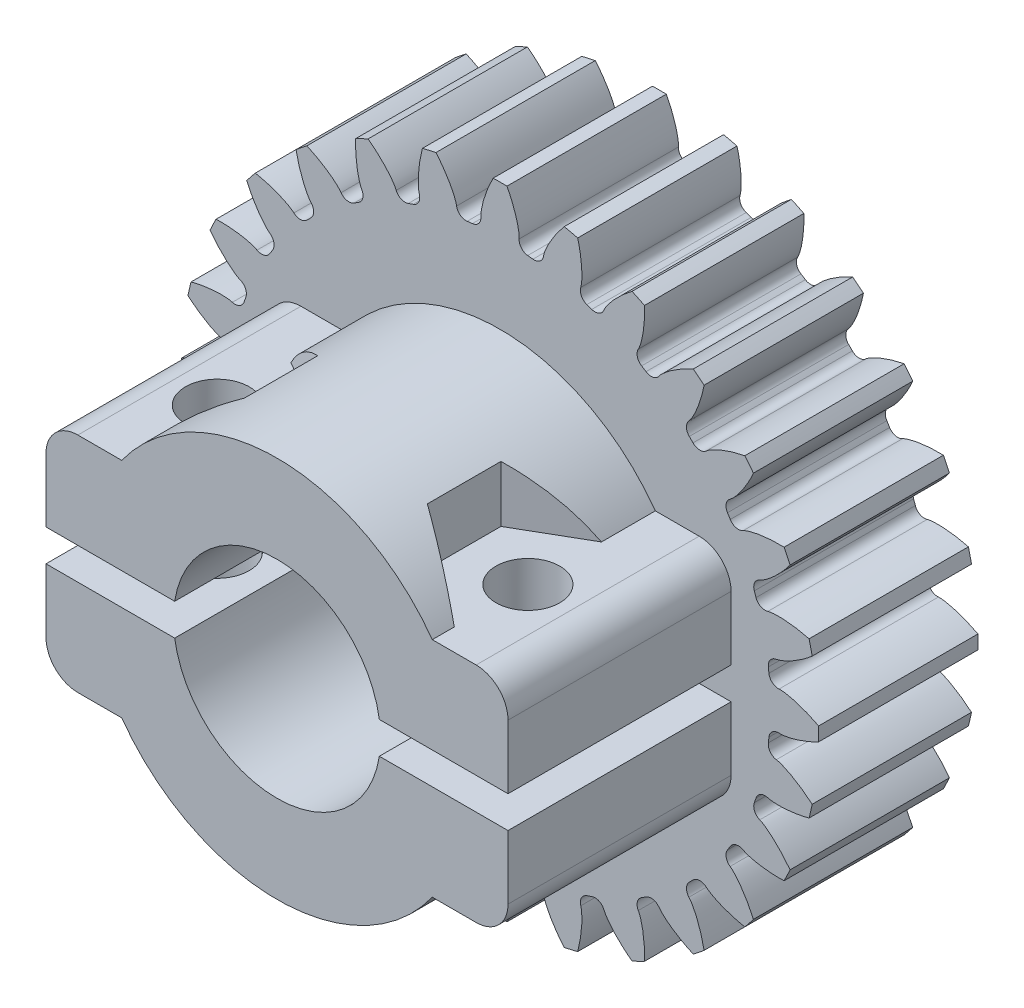
from build123d import *

# Parameters (mm, degrees)
BOSS_EXTRUDE1_DEPTH      = 5
F_6_0_6_DIAMETER_HOLE1_D = 6
FILLET1_R                = 0.300012354
SKETCH4_R                = 6
SKETCH4_R_2              = 3
BOSS_EXTRUDE2_DEPTH      = 7
CUT_EXTRUDE1_DEPTH       = 10
CUT_EXTRUDE1_DEPTH_BACK  = 11.5
SKETCH5_R                = 3.25
SKETCH5_R_2              = 1
BOSS_EXTRUDE3_DEPTH      = 7
SKETCH7_W                = 14.5
SKETCH7_H                = 1
CUT_EXTRUDE2_DEPTH       = 7
SKETCH8_R                = 1
CUT_EXTRUDE3_DEPTH       = 7
SKETCH9_R                = 2
CUT_EXTRUDE4_DEPTH       = 7
CUT_EXTRUDE5_DEPTH       = 7


with BuildPart() as part:
    # Sketch1 → Boss-Extrude1 (new body)
    with BuildSketch(Plane.XY.offset(3)):
        with BuildLine():
            ThreePointArc((9.698727559, -2.436120634), (9.749279122, -2.22520934), (9.795244718, -2.013251328))
            add(Edge.make_bspline(
                [(9.795244718, -2.013251328), (9.132310444, -1.434916085), (8.667338514, -1.363860765)],
                knots=[1.102675536, 1.102675536, 1.102675536, 2.694068119, 2.694068119, 2.694068119], degree=2, weights=[1, 0.699787539, 1]))
            add(Edge.make_bspline(
                [(8.667338514, -1.363860765), (8.571579262, -1.347671583), (8.475468614, -1.333203337), (8.379532055, -1.317882503)],
                knots=[0, 0, 0, 0, 1, 1, 1, 1], degree=3))
            ThreePointArc((8.379532055, -1.317882503), (8.429196944, -0.949742401), (8.462696137, -0.579780862))
            add(Edge.make_bspline(
                [(8.753517812, -0.598998333), (8.656557013, -0.59347318), (8.559636572, -0.586192045), (8.462696137, -0.579780862)],
                knots=[0, 0, 0, 0, 1, 1, 1, 1], degree=3))
            add(Edge.make_bspline(
                [(8.753517812, -0.598998333), (9.236542381, -0.624281572), (9.997648048, -0.216872089)],
                knots=[3.629487151, 3.629487151, 3.629487151, 5.119391363, 5.119391363, 5.119391363], degree=2, weights=[1, 0.735120372, 1]))
            ThreePointArc((9.997648048, -0.216872089), (10, 0), (9.997648048, 0.216872089))
            add(Edge.make_bspline(
                [(9.997648048, 0.216872089), (9.222643222, 0.633190506), (8.753517812, 0.598998333)],
                knots=[1.102675536, 1.102675536, 1.102675536, 2.694068119, 2.694068119, 2.694068119], degree=2, weights=[1, 0.699787539, 1]))
            add(Edge.make_bspline(
                [(8.753517812, 0.598998333), (8.656557013, 0.59347318), (8.559636572, 0.586192045), (8.462696137, 0.579780862)],
                knots=[0, 0, 0, 0, 1, 1, 1, 1], degree=3))
            ThreePointArc((8.462696137, 0.579780862), (8.429196944, 0.949742401), (8.379532055, 1.317882503))
            add(Edge.make_bspline(
                [(8.667338514, 1.363860765), (8.571579262, 1.347671583), (8.475468614, 1.333203337), (8.379532055, 1.317882503)],
                knots=[0, 0, 0, 0, 1, 1, 1, 1], degree=3))
            add(Edge.make_bspline(
                [(8.667338514, 1.363860765), (9.143878697, 1.446694507), (9.795244718, 2.013251328)],
                knots=[3.629487151, 3.629487151, 3.629487151, 5.119391363, 5.119391363, 5.119391363], degree=2, weights=[1, 0.735120372, 1]))
            ThreePointArc((9.795244718, 2.013251328), (9.749279122, 2.22520934), (9.698727559, 2.436120634))
            add(Edge.make_bspline(
                [(9.698727559, 2.436120634), (8.850514158, 2.669546282), (8.400759177, 2.531821153)],
                knots=[1.102675536, 1.102675536, 1.102675536, 2.694068119, 2.694068119, 2.694068119], degree=2, weights=[1, 0.699787539, 1]))
            add(Edge.make_bspline(
                [(8.400759177, 2.531821153), (8.307458849, 2.50485872), (8.214588611, 2.476193311), (8.121505297, 2.448371593)],
                knots=[0, 0, 0, 0, 1, 1, 1, 1], degree=3))
            ThreePointArc((8.121505297, 2.448371593), (8.006521812, 2.801603152), (7.876183246, 3.149461736))
            add(Edge.make_bspline(
                [(8.14654267, 3.258330189), (8.056786734, 3.221238466), (7.966305269, 3.185746338), (7.876183246, 3.149461736)],
                knots=[0, 0, 0, 0, 1, 1, 1, 1], degree=3))
            add(Edge.make_bspline(
                [(8.14654267, 3.258330189), (8.592702755, 3.445127283), (9.101666916, 4.142421917)],
                knots=[0.487894497, 0.487894497, 0.487894497, 1.97779871, 1.97779871, 1.97779871], degree=2, weights=[1, 0.735120372, 1]))
            ThreePointArc((9.101666916, 4.142421917), (9.009688679, 4.338837391), (8.913472371, 4.533211918))
            add(Edge.make_bspline(
                [(8.913472371, 4.533211918), (8.034583358, 4.572039859), (7.626751397, 4.337687889)],
                knots=[1.102675536, 1.102675536, 1.102675536, 2.694068119, 2.694068119, 2.694068119], degree=2, weights=[1, 0.699787539, 1]))
            add(Edge.make_bspline(
                [(7.626751397, 4.337687889), (7.54179001, 4.290640184), (7.457626876, 4.242027905), (7.37306827, 4.194190749)],
                knots=[0, 0, 0, 0, 1, 1, 1, 1], degree=3))
            ThreePointArc((7.37306827, 4.194190749), (7.182366244, 4.512979823), (6.977889721, 4.823113807))
            add(Edge.make_bspline(
                [(7.21724516, 4.989413332), (7.137993278, 4.933279001), (7.057678113, 4.878542714), (6.977889721, 4.823113807)],
                knots=[0, 0, 0, 0, 1, 1, 1, 1], degree=3))
            add(Edge.make_bspline(
                [(7.21724516, 4.989413332), (7.610652816, 5.270806992), (7.95169353, 6.063874174)],
                knots=[3.629487151, 3.629487151, 3.629487151, 5.119391363, 5.119391363, 5.119391363], degree=2, weights=[1, 0.735120372, 1]))
            ThreePointArc((7.95169353, 6.063874174), (7.818314825, 6.234898019), (7.681258459, 6.402989027))
            add(Edge.make_bspline(
                [(7.681258459, 6.402989027), (6.815764999, 6.245272267), (6.470306456, 5.926044841)],
                knots=[1.102675536, 1.102675536, 1.102675536, 2.694068119, 2.694068119, 2.694068119], degree=2, weights=[1, 0.699787539, 1]))
            add(Edge.make_bspline(
                [(6.470306456, 5.926044841), (6.397944327, 5.861271033), (6.326708588, 5.795149506), (6.254914812, 5.729695668)],
                knots=[0, 0, 0, 0, 1, 1, 1, 1], degree=3))
            ThreePointArc((6.254914812, 5.729695668), (5.998056842, 5.998056842), (5.729695668, 6.254914812))
            add(Edge.make_bspline(
                [(5.926044841, 6.470306456), (5.861271033, 6.397944327), (5.795149506, 6.326708588), (5.729695668, 6.254914812)],
                knots=[0, 0, 0, 0, 1, 1, 1, 1], degree=3))
            add(Edge.make_bspline(
                [(5.926044841, 6.470306456), (6.246972966, 6.832186429), (6.402989027, 7.681258459)],
                knots=[0.487894497, 0.487894497, 0.487894497, 1.97779871, 1.97779871, 1.97779871], degree=2, weights=[1, 0.735120372, 1]))
            ThreePointArc((6.402989027, 7.681258459), (6.234898019, 7.818314825), (6.063874174, 7.95169353))
            add(Edge.make_bspline(
                [(6.063874174, 7.95169353), (5.255175723, 7.605340646), (4.989413332, 7.21724516)],
                knots=[1.102675536, 1.102675536, 1.102675536, 2.694068119, 2.694068119, 2.694068119], degree=2, weights=[1, 0.699787539, 1]))
            add(Edge.make_bspline(
                [(4.989413332, 7.21724516), (4.933279001, 7.137993278), (4.878542714, 7.057678113), (4.823113807, 6.977889721)],
                knots=[0, 0, 0, 0, 1, 1, 1, 1], degree=3))
            ThreePointArc((4.823113807, 6.977889721), (4.512979823, 7.182366244), (4.194190749, 7.37306827))
            add(Edge.make_bspline(
                [(4.337687889, 7.626751397), (4.290640184, 7.54179001), (4.242027905, 7.457626876), (4.194190749, 7.37306827)],
                knots=[0, 0, 0, 0, 1, 1, 1, 1], degree=3))
            add(Edge.make_bspline(
                [(4.337687889, 7.626751397), (4.570043806, 8.050971509), (4.533211918, 8.913472371)],
                knots=[0.487894497, 0.487894497, 0.487894497, 1.97779871, 1.97779871, 1.97779871], degree=2, weights=[1, 0.735120372, 1]))
            ThreePointArc((4.533211918, 8.913472371), (4.338837391, 9.009688679), (4.142421917, 9.101666916))
            add(Edge.make_bspline(
                [(4.142421917, 9.101666916), (3.431069992, 8.584045487), (3.258330189, 8.14654267)],
                knots=[1.102675536, 1.102675536, 1.102675536, 2.694068119, 2.694068119, 2.694068119], degree=2, weights=[1, 0.699787539, 1]))
            add(Edge.make_bspline(
                [(3.258330189, 8.14654267), (3.221238466, 8.056786734), (3.185746338, 7.966305269), (3.149461736, 7.876183246)],
                knots=[0, 0, 0, 0, 1, 1, 1, 1], degree=3))
            ThreePointArc((3.149461736, 7.876183246), (2.801603152, 8.006521812), (2.448371593, 8.121505297))
            add(Edge.make_bspline(
                [(2.531821153, 8.400759177), (2.50485872, 8.307458849), (2.476193311, 8.214588611), (2.448371593, 8.121505297)],
                knots=[0, 0, 0, 0, 1, 1, 1, 1], degree=3))
            add(Edge.make_bspline(
                [(2.531821153, 8.400759177), (2.663953567, 8.866047261), (2.436120634, 9.698727559)],
                knots=[0.487894497, 0.487894497, 0.487894497, 1.97779871, 1.97779871, 1.97779871], degree=2, weights=[1, 0.735120372, 1]))
            ThreePointArc((2.436120634, 9.698727559), (2.22520934, 9.749279122), (2.013251328, 9.795244718))
            add(Edge.make_bspline(
                [(2.013251328, 9.795244718), (1.434916085, 9.132310444), (1.363860765, 8.667338514)],
                knots=[4.24426819, 4.24426819, 4.24426819, 5.835660772, 5.835660772, 5.835660772], degree=2, weights=[1, 0.699787539, 1]))
            add(Edge.make_bspline(
                [(1.363860765, 8.667338514), (1.347671583, 8.571579262), (1.333203337, 8.475468614), (1.317882503, 8.379532055)],
                knots=[0, 0, 0, 0, 1, 1, 1, 1], degree=3))
            ThreePointArc((1.317882503, 8.379532055), (0.949742401, 8.429196944), (0.579780862, 8.462696137))
            add(Edge.make_bspline(
                [(0.598998333, 8.753517812), (0.59347318, 8.656557013), (0.586192045, 8.559636572), (0.579780862, 8.462696137)],
                knots=[0, 0, 0, 0, 1, 1, 1, 1], degree=3))
            add(Edge.make_bspline(
                [(0.598998333, 8.753517812), (0.624281572, 9.236542381), (0.216872089, 9.997648048)],
                knots=[0.487894497, 0.487894497, 0.487894497, 1.97779871, 1.97779871, 1.97779871], degree=2, weights=[1, 0.735120372, 1]))
            ThreePointArc((0.216872089, 9.997648048), (0, 10), (-0.216872089, 9.997648048))
            add(Edge.make_bspline(
                [(-0.216872089, 9.997648048), (-0.633190506, 9.222643222), (-0.598998333, 8.753517812)],
                knots=[4.24426819, 4.24426819, 4.24426819, 5.835660772, 5.835660772, 5.835660772], degree=2, weights=[1, 0.699787539, 1]))
            add(Edge.make_bspline(
                [(-0.598998333, 8.753517812), (-0.59347318, 8.656557013), (-0.586192045, 8.559636572), (-0.579780862, 8.462696137)],
                knots=[0, 0, 0, 0, 1, 1, 1, 1], degree=3))
            ThreePointArc((-0.579780862, 8.462696137), (-0.949742401, 8.429196944), (-1.317882503, 8.379532055))
            add(Edge.make_bspline(
                [(-1.363860765, 8.667338514), (-1.347671583, 8.571579262), (-1.333203337, 8.475468614), (-1.317882503, 8.379532055)],
                knots=[0, 0, 0, 0, 1, 1, 1, 1], degree=3))
            add(Edge.make_bspline(
                [(-1.363860765, 8.667338514), (-1.446694507, 9.143878697), (-2.013251328, 9.795244718)],
                knots=[0.487894497, 0.487894497, 0.487894497, 1.97779871, 1.97779871, 1.97779871], degree=2, weights=[1, 0.735120372, 1]))
            ThreePointArc((-2.013251328, 9.795244718), (-2.22520934, 9.749279122), (-2.436120634, 9.698727559))
            add(Edge.make_bspline(
                [(-2.436120634, 9.698727559), (-2.669546282, 8.850514158), (-2.531821153, 8.400759177)],
                knots=[4.24426819, 4.24426819, 4.24426819, 5.835660772, 5.835660772, 5.835660772], degree=2, weights=[1, 0.699787539, 1]))
            add(Edge.make_bspline(
                [(-2.531821153, 8.400759177), (-2.50485872, 8.307458849), (-2.476193311, 8.214588611), (-2.448371593, 8.121505297)],
                knots=[0, 0, 0, 0, 1, 1, 1, 1], degree=3))
            ThreePointArc((-2.448371593, 8.121505297), (-2.801603152, 8.006521812), (-3.149461736, 7.876183246))
            add(Edge.make_bspline(
                [(-3.258330189, 8.14654267), (-3.221238466, 8.056786734), (-3.185746338, 7.966305269), (-3.149461736, 7.876183246)],
                knots=[0, 0, 0, 0, 1, 1, 1, 1], degree=3))
            add(Edge.make_bspline(
                [(-3.258330189, 8.14654267), (-3.445127283, 8.592702755), (-4.142421917, 9.101666916)],
                knots=[0.487894497, 0.487894497, 0.487894497, 1.97779871, 1.97779871, 1.97779871], degree=2, weights=[1, 0.735120372, 1]))
            ThreePointArc((-4.142421917, 9.101666916), (-4.338837391, 9.009688679), (-4.533211918, 8.913472371))
            add(Edge.make_bspline(
                [(-4.533211918, 8.913472371), (-4.572039859, 8.034583358), (-4.337687889, 7.626751397)],
                knots=[4.24426819, 4.24426819, 4.24426819, 5.835660772, 5.835660772, 5.835660772], degree=2, weights=[1, 0.699787539, 1]))
            add(Edge.make_bspline(
                [(-4.337687889, 7.626751397), (-4.290640184, 7.54179001), (-4.242027905, 7.457626876), (-4.194190749, 7.37306827)],
                knots=[0, 0, 0, 0, 1, 1, 1, 1], degree=3))
            ThreePointArc((-4.194190749, 7.37306827), (-4.512979823, 7.182366244), (-4.823113807, 6.977889721))
            add(Edge.make_bspline(
                [(-4.989413332, 7.21724516), (-4.933279001, 7.137993278), (-4.878542714, 7.057678113), (-4.823113807, 6.977889721)],
                knots=[0, 0, 0, 0, 1, 1, 1, 1], degree=3))
            add(Edge.make_bspline(
                [(-4.989413332, 7.21724516), (-5.270806992, 7.610652816), (-6.063874174, 7.95169353)],
                knots=[0.487894497, 0.487894497, 0.487894497, 1.97779871, 1.97779871, 1.97779871], degree=2, weights=[1, 0.735120372, 1]))
            ThreePointArc((-6.063874174, 7.95169353), (-6.234898019, 7.818314825), (-6.402989027, 7.681258459))
            add(Edge.make_bspline(
                [(-6.402989027, 7.681258459), (-6.245272267, 6.815764999), (-5.926044841, 6.470306456)],
                knots=[4.24426819, 4.24426819, 4.24426819, 5.835660772, 5.835660772, 5.835660772], degree=2, weights=[1, 0.699787539, 1]))
            add(Edge.make_bspline(
                [(-5.926044841, 6.470306456), (-5.861271033, 6.397944327), (-5.795149506, 6.326708588), (-5.729695668, 6.254914812)],
                knots=[0, 0, 0, 0, 1, 1, 1, 1], degree=3))
            ThreePointArc((-5.729695668, 6.254914812), (-5.998056842, 5.998056842), (-6.254914812, 5.729695668))
            add(Edge.make_bspline(
                [(-6.470306456, 5.926044841), (-6.397944327, 5.861271033), (-6.326708588, 5.795149506), (-6.254914812, 5.729695668)],
                knots=[0, 0, 0, 0, 1, 1, 1, 1], degree=3))
            add(Edge.make_bspline(
                [(-6.470306456, 5.926044841), (-6.832186429, 6.246972966), (-7.681258459, 6.402989027)],
                knots=[0.487894497, 0.487894497, 0.487894497, 1.97779871, 1.97779871, 1.97779871], degree=2, weights=[1, 0.735120372, 1]))
            ThreePointArc((-7.681258459, 6.402989027), (-7.818314825, 6.234898019), (-7.95169353, 6.063874174))
            add(Edge.make_bspline(
                [(-7.95169353, 6.063874174), (-7.605340646, 5.255175723), (-7.21724516, 4.989413332)],
                knots=[1.102675536, 1.102675536, 1.102675536, 2.694068119, 2.694068119, 2.694068119], degree=2, weights=[1, 0.699787539, 1]))
            add(Edge.make_bspline(
                [(-7.21724516, 4.989413332), (-7.137993278, 4.933279001), (-7.057678113, 4.878542714), (-6.977889721, 4.823113807)],
                knots=[0, 0, 0, 0, 1, 1, 1, 1], degree=3))
            ThreePointArc((-6.977889721, 4.823113807), (-7.182366244, 4.512979823), (-7.37306827, 4.194190749))
            add(Edge.make_bspline(
                [(-7.626751397, 4.337687889), (-7.54179001, 4.290640184), (-7.457626876, 4.242027905), (-7.37306827, 4.194190749)],
                knots=[0, 0, 0, 0, 1, 1, 1, 1], degree=3))
            add(Edge.make_bspline(
                [(-7.626751397, 4.337687889), (-8.050971509, 4.570043806), (-8.913472371, 4.533211918)],
                knots=[3.629487151, 3.629487151, 3.629487151, 5.119391363, 5.119391363, 5.119391363], degree=2, weights=[1, 0.735120372, 1]))
            ThreePointArc((-8.913472371, 4.533211918), (-9.009688679, 4.338837391), (-9.101666916, 4.142421917))
            add(Edge.make_bspline(
                [(-9.101666916, 4.142421917), (-8.584045487, 3.431069992), (-8.14654267, 3.258330189)],
                knots=[4.24426819, 4.24426819, 4.24426819, 5.835660772, 5.835660772, 5.835660772], degree=2, weights=[1, 0.699787539, 1]))
            add(Edge.make_bspline(
                [(-8.14654267, 3.258330189), (-8.056786734, 3.221238466), (-7.966305269, 3.185746338), (-7.876183246, 3.149461736)],
                knots=[0, 0, 0, 0, 1, 1, 1, 1], degree=3))
            ThreePointArc((-7.876183246, 3.149461736), (-8.006521812, 2.801603152), (-8.121505297, 2.448371593))
            add(Edge.make_bspline(
                [(-8.400759177, 2.531821153), (-8.307458849, 2.50485872), (-8.214588611, 2.476193311), (-8.121505297, 2.448371593)],
                knots=[0, 0, 0, 0, 1, 1, 1, 1], degree=3))
            add(Edge.make_bspline(
                [(-8.400759177, 2.531821153), (-8.866047261, 2.663953567), (-9.698727559, 2.436120634)],
                knots=[0.487894497, 0.487894497, 0.487894497, 1.97779871, 1.97779871, 1.97779871], degree=2, weights=[1, 0.735120372, 1]))
            ThreePointArc((-9.698727559, 2.436120634), (-9.749279122, 2.22520934), (-9.795244718, 2.013251328))
            add(Edge.make_bspline(
                [(-9.795244718, 2.013251328), (-9.132310444, 1.434916085), (-8.667338514, 1.363860765)],
                knots=[4.24426819, 4.24426819, 4.24426819, 5.835660772, 5.835660772, 5.835660772], degree=2, weights=[1, 0.699787539, 1]))
            add(Edge.make_bspline(
                [(-8.667338514, 1.363860765), (-8.571579262, 1.347671583), (-8.475468614, 1.333203337), (-8.379532055, 1.317882503)],
                knots=[0, 0, 0, 0, 1, 1, 1, 1], degree=3))
            ThreePointArc((-8.379532055, 1.317882503), (-8.429196944, 0.949742401), (-8.462696137, 0.579780862))
            add(Edge.make_bspline(
                [(-8.753517812, 0.598998333), (-8.656557013, 0.59347318), (-8.559636572, 0.586192045), (-8.462696137, 0.579780862)],
                knots=[0, 0, 0, 0, 1, 1, 1, 1], degree=3))
            add(Edge.make_bspline(
                [(-8.753517812, 0.598998333), (-9.236542381, 0.624281572), (-9.997648048, 0.216872089)],
                knots=[0.487894497, 0.487894497, 0.487894497, 1.97779871, 1.97779871, 1.97779871], degree=2, weights=[1, 0.735120372, 1]))
            ThreePointArc((-9.997648048, 0.216872089), (-10, 0), (-9.997648048, -0.216872089))
            add(Edge.make_bspline(
                [(-9.997648048, -0.216872089), (-9.222643222, -0.633190506), (-8.753517812, -0.598998333)],
                knots=[4.24426819, 4.24426819, 4.24426819, 5.835660772, 5.835660772, 5.835660772], degree=2, weights=[1, 0.699787539, 1]))
            add(Edge.make_bspline(
                [(-8.753517812, -0.598998333), (-8.656557013, -0.59347318), (-8.559636572, -0.586192045), (-8.462696137, -0.579780862)],
                knots=[0, 0, 0, 0, 1, 1, 1, 1], degree=3))
            ThreePointArc((-8.462696137, -0.579780862), (-8.429196944, -0.949742401), (-8.379532055, -1.317882503))
            add(Edge.make_bspline(
                [(-8.667338514, -1.363860765), (-8.571579262, -1.347671583), (-8.475468614, -1.333203337), (-8.379532055, -1.317882503)],
                knots=[0, 0, 0, 0, 1, 1, 1, 1], degree=3))
            add(Edge.make_bspline(
                [(-8.667338514, -1.363860765), (-9.143878697, -1.446694507), (-9.795244718, -2.013251328)],
                knots=[0.487894497, 0.487894497, 0.487894497, 1.97779871, 1.97779871, 1.97779871], degree=2, weights=[1, 0.735120372, 1]))
            ThreePointArc((-9.795244718, -2.013251328), (-9.749279122, -2.22520934), (-9.698727559, -2.436120634))
            add(Edge.make_bspline(
                [(-9.698727559, -2.436120634), (-8.850514158, -2.669546282), (-8.400759177, -2.531821153)],
                knots=[4.24426819, 4.24426819, 4.24426819, 5.835660772, 5.835660772, 5.835660772], degree=2, weights=[1, 0.699787539, 1]))
            add(Edge.make_bspline(
                [(-8.400759177, -2.531821153), (-8.307458849, -2.50485872), (-8.214588611, -2.476193311), (-8.121505297, -2.448371593)],
                knots=[0, 0, 0, 0, 1, 1, 1, 1], degree=3))
            ThreePointArc((-8.121505297, -2.448371593), (-8.006521812, -2.801603152), (-7.876183246, -3.149461736))
            add(Edge.make_bspline(
                [(-8.14654267, -3.258330189), (-8.056786734, -3.221238466), (-7.966305269, -3.185746338), (-7.876183246, -3.149461736)],
                knots=[0, 0, 0, 0, 1, 1, 1, 1], degree=3))
            add(Edge.make_bspline(
                [(-8.14654267, -3.258330189), (-8.592702755, -3.445127283), (-9.101666916, -4.142421917)],
                knots=[3.629487151, 3.629487151, 3.629487151, 5.119391363, 5.119391363, 5.119391363], degree=2, weights=[1, 0.735120372, 1]))
            ThreePointArc((-9.101666916, -4.142421917), (-9.009688679, -4.338837391), (-8.913472371, -4.533211918))
            add(Edge.make_bspline(
                [(-8.913472371, -4.533211918), (-8.034583358, -4.572039859), (-7.626751397, -4.337687889)],
                knots=[4.24426819, 4.24426819, 4.24426819, 5.835660772, 5.835660772, 5.835660772], degree=2, weights=[1, 0.699787539, 1]))
            add(Edge.make_bspline(
                [(-7.626751397, -4.337687889), (-7.54179001, -4.290640184), (-7.457626876, -4.242027905), (-7.37306827, -4.194190749)],
                knots=[0, 0, 0, 0, 1, 1, 1, 1], degree=3))
            ThreePointArc((-7.37306827, -4.194190749), (-7.182366244, -4.512979823), (-6.977889721, -4.823113807))
            add(Edge.make_bspline(
                [(-7.21724516, -4.989413332), (-7.137993278, -4.933279001), (-7.057678113, -4.878542714), (-6.977889721, -4.823113807)],
                knots=[0, 0, 0, 0, 1, 1, 1, 1], degree=3))
            add(Edge.make_bspline(
                [(-7.21724516, -4.989413332), (-7.610652816, -5.270806992), (-7.95169353, -6.063874174)],
                knots=[3.629487151, 3.629487151, 3.629487151, 5.119391363, 5.119391363, 5.119391363], degree=2, weights=[1, 0.735120372, 1]))
            ThreePointArc((-7.95169353, -6.063874174), (-7.818314825, -6.234898019), (-7.681258459, -6.402989027))
            add(Edge.make_bspline(
                [(-7.681258459, -6.402989027), (-6.815764999, -6.245272267), (-6.470306456, -5.926044841)],
                knots=[4.24426819, 4.24426819, 4.24426819, 5.835660772, 5.835660772, 5.835660772], degree=2, weights=[1, 0.699787539, 1]))
            add(Edge.make_bspline(
                [(-6.470306456, -5.926044841), (-6.397944327, -5.861271033), (-6.326708588, -5.795149506), (-6.254914812, -5.729695668)],
                knots=[0, 0, 0, 0, 1, 1, 1, 1], degree=3))
            ThreePointArc((-6.254914812, -5.729695668), (-5.998056842, -5.998056842), (-5.729695668, -6.254914812))
            add(Edge.make_bspline(
                [(-5.926044841, -6.470306456), (-5.861271033, -6.397944327), (-5.795149506, -6.326708588), (-5.729695668, -6.254914812)],
                knots=[0, 0, 0, 0, 1, 1, 1, 1], degree=3))
            add(Edge.make_bspline(
                [(-5.926044841, -6.470306456), (-6.246972966, -6.832186429), (-6.402989027, -7.681258459)],
                knots=[3.629487151, 3.629487151, 3.629487151, 5.119391363, 5.119391363, 5.119391363], degree=2, weights=[1, 0.735120372, 1]))
            ThreePointArc((-6.402989027, -7.681258459), (-6.234898019, -7.818314825), (-6.063874174, -7.95169353))
            add(Edge.make_bspline(
                [(-6.063874174, -7.95169353), (-5.255175723, -7.605340646), (-4.989413332, -7.21724516)],
                knots=[4.24426819, 4.24426819, 4.24426819, 5.835660772, 5.835660772, 5.835660772], degree=2, weights=[1, 0.699787539, 1]))
            add(Edge.make_bspline(
                [(-4.989413332, -7.21724516), (-4.933279001, -7.137993278), (-4.878542714, -7.057678113), (-4.823113807, -6.977889721)],
                knots=[0, 0, 0, 0, 1, 1, 1, 1], degree=3))
            ThreePointArc((-4.823113807, -6.977889721), (-4.512979823, -7.182366244), (-4.194190749, -7.37306827))
            add(Edge.make_bspline(
                [(-4.337687889, -7.626751397), (-4.290640184, -7.54179001), (-4.242027905, -7.457626876), (-4.194190749, -7.37306827)],
                knots=[0, 0, 0, 0, 1, 1, 1, 1], degree=3))
            add(Edge.make_bspline(
                [(-4.337687889, -7.626751397), (-4.570043806, -8.050971509), (-4.533211918, -8.913472371)],
                knots=[3.629487151, 3.629487151, 3.629487151, 5.119391363, 5.119391363, 5.119391363], degree=2, weights=[1, 0.735120372, 1]))
            ThreePointArc((-4.533211918, -8.913472371), (-4.338837391, -9.009688679), (-4.142421917, -9.101666916))
            add(Edge.make_bspline(
                [(-4.142421917, -9.101666916), (-3.431069992, -8.584045487), (-3.258330189, -8.14654267)],
                knots=[4.24426819, 4.24426819, 4.24426819, 5.835660772, 5.835660772, 5.835660772], degree=2, weights=[1, 0.699787539, 1]))
            add(Edge.make_bspline(
                [(-3.258330189, -8.14654267), (-3.221238466, -8.056786734), (-3.185746338, -7.966305269), (-3.149461736, -7.876183246)],
                knots=[0, 0, 0, 0, 1, 1, 1, 1], degree=3))
            ThreePointArc((-3.149461736, -7.876183246), (-2.801603152, -8.006521812), (-2.448371593, -8.121505297))
            add(Edge.make_bspline(
                [(-2.531821153, -8.400759177), (-2.50485872, -8.307458849), (-2.476193311, -8.214588611), (-2.448371593, -8.121505297)],
                knots=[0, 0, 0, 0, 1, 1, 1, 1], degree=3))
            add(Edge.make_bspline(
                [(-2.531821153, -8.400759177), (-2.663953567, -8.866047261), (-2.436120634, -9.698727559)],
                knots=[3.629487151, 3.629487151, 3.629487151, 5.119391363, 5.119391363, 5.119391363], degree=2, weights=[1, 0.735120372, 1]))
            ThreePointArc((-2.436120634, -9.698727559), (-2.22520934, -9.749279122), (-2.013251328, -9.795244718))
            add(Edge.make_bspline(
                [(-2.013251328, -9.795244718), (-1.434916085, -9.132310444), (-1.363860765, -8.667338514)],
                knots=[1.102675536, 1.102675536, 1.102675536, 2.694068119, 2.694068119, 2.694068119], degree=2, weights=[1, 0.699787539, 1]))
            add(Edge.make_bspline(
                [(-1.363860765, -8.667338514), (-1.347671583, -8.571579262), (-1.333203337, -8.475468614), (-1.317882503, -8.379532055)],
                knots=[0, 0, 0, 0, 1, 1, 1, 1], degree=3))
            ThreePointArc((-1.317882503, -8.379532055), (-0.949742401, -8.429196944), (-0.579780862, -8.462696137))
            add(Edge.make_bspline(
                [(-0.598998333, -8.753517812), (-0.59347318, -8.656557013), (-0.586192045, -8.559636572), (-0.579780862, -8.462696137)],
                knots=[0, 0, 0, 0, 1, 1, 1, 1], degree=3))
            add(Edge.make_bspline(
                [(-0.598998333, -8.753517812), (-0.624281572, -9.236542381), (-0.216872089, -9.997648048)],
                knots=[3.629487151, 3.629487151, 3.629487151, 5.119391363, 5.119391363, 5.119391363], degree=2, weights=[1, 0.735120372, 1]))
            ThreePointArc((-0.216872089, -9.997648048), (0, -10), (0.216872089, -9.997648048))
            add(Edge.make_bspline(
                [(0.216872089, -9.997648048), (0.633190506, -9.222643222), (0.598998333, -8.753517812)],
                knots=[1.102675536, 1.102675536, 1.102675536, 2.694068119, 2.694068119, 2.694068119], degree=2, weights=[1, 0.699787539, 1]))
            add(Edge.make_bspline(
                [(0.598998333, -8.753517812), (0.59347318, -8.656557013), (0.586192045, -8.559636572), (0.579780862, -8.462696137)],
                knots=[0, 0, 0, 0, 1, 1, 1, 1], degree=3))
            ThreePointArc((0.579780862, -8.462696137), (0.949742401, -8.429196944), (1.317882503, -8.379532055))
            add(Edge.make_bspline(
                [(1.363860765, -8.667338514), (1.347671583, -8.571579262), (1.333203337, -8.475468614), (1.317882503, -8.379532055)],
                knots=[0, 0, 0, 0, 1, 1, 1, 1], degree=3))
            add(Edge.make_bspline(
                [(1.363860765, -8.667338514), (1.446694507, -9.143878697), (2.013251328, -9.795244718)],
                knots=[3.629487151, 3.629487151, 3.629487151, 5.119391363, 5.119391363, 5.119391363], degree=2, weights=[1, 0.735120372, 1]))
            ThreePointArc((2.013251328, -9.795244718), (2.22520934, -9.749279122), (2.436120634, -9.698727559))
            add(Edge.make_bspline(
                [(2.436120634, -9.698727559), (2.669546282, -8.850514158), (2.531821153, -8.400759177)],
                knots=[1.102675536, 1.102675536, 1.102675536, 2.694068119, 2.694068119, 2.694068119], degree=2, weights=[1, 0.699787539, 1]))
            add(Edge.make_bspline(
                [(2.531821153, -8.400759177), (2.50485872, -8.307458849), (2.476193311, -8.214588611), (2.448371593, -8.121505297)],
                knots=[0, 0, 0, 0, 1, 1, 1, 1], degree=3))
            ThreePointArc((2.448371593, -8.121505297), (2.801603152, -8.006521812), (3.149461736, -7.876183246))
            add(Edge.make_bspline(
                [(3.258330189, -8.14654267), (3.221238466, -8.056786734), (3.185746338, -7.966305269), (3.149461736, -7.876183246)],
                knots=[0, 0, 0, 0, 1, 1, 1, 1], degree=3))
            add(Edge.make_bspline(
                [(3.258330189, -8.14654267), (3.445127283, -8.592702755), (4.142421917, -9.101666916)],
                knots=[3.629487151, 3.629487151, 3.629487151, 5.119391363, 5.119391363, 5.119391363], degree=2, weights=[1, 0.735120372, 1]))
            ThreePointArc((4.142421917, -9.101666916), (4.338837391, -9.009688679), (4.533211918, -8.913472371))
            add(Edge.make_bspline(
                [(4.533211918, -8.913472371), (4.572039859, -8.034583358), (4.337687889, -7.626751397)],
                knots=[1.102675536, 1.102675536, 1.102675536, 2.694068119, 2.694068119, 2.694068119], degree=2, weights=[1, 0.699787539, 1]))
            add(Edge.make_bspline(
                [(4.337687889, -7.626751397), (4.290640184, -7.54179001), (4.242027905, -7.457626876), (4.194190749, -7.37306827)],
                knots=[0, 0, 0, 0, 1, 1, 1, 1], degree=3))
            ThreePointArc((4.194190749, -7.37306827), (4.512979823, -7.182366244), (4.823113807, -6.977889721))
            add(Edge.make_bspline(
                [(4.989413332, -7.21724516), (4.933279001, -7.137993278), (4.878542714, -7.057678113), (4.823113807, -6.977889721)],
                knots=[0, 0, 0, 0, 1, 1, 1, 1], degree=3))
            add(Edge.make_bspline(
                [(4.989413332, -7.21724516), (5.270806992, -7.610652816), (6.063874174, -7.95169353)],
                knots=[3.629487151, 3.629487151, 3.629487151, 5.119391363, 5.119391363, 5.119391363], degree=2, weights=[1, 0.735120372, 1]))
            ThreePointArc((6.063874174, -7.95169353), (6.234898019, -7.818314825), (6.402989027, -7.681258459))
            add(Edge.make_bspline(
                [(6.402989027, -7.681258459), (6.245272267, -6.815764999), (5.926044841, -6.470306456)],
                knots=[4.24426819, 4.24426819, 4.24426819, 5.835660772, 5.835660772, 5.835660772], degree=2, weights=[1, 0.699787539, 1]))
            add(Edge.make_bspline(
                [(5.926044841, -6.470306456), (5.861271033, -6.397944327), (5.795149506, -6.326708588), (5.729695668, -6.254914812)],
                knots=[0, 0, 0, 0, 1, 1, 1, 1], degree=3))
            ThreePointArc((5.729695668, -6.254914812), (5.998056842, -5.998056842), (6.254914812, -5.729695668))
            add(Edge.make_bspline(
                [(6.470306456, -5.926044841), (6.397944327, -5.861271033), (6.326708588, -5.795149506), (6.254914812, -5.729695668)],
                knots=[0, 0, 0, 0, 1, 1, 1, 1], degree=3))
            add(Edge.make_bspline(
                [(6.470306456, -5.926044841), (6.832186429, -6.246972966), (7.681258459, -6.402989027)],
                knots=[3.629487151, 3.629487151, 3.629487151, 5.119391363, 5.119391363, 5.119391363], degree=2, weights=[1, 0.735120372, 1]))
            ThreePointArc((7.681258459, -6.402989027), (7.818314825, -6.234898019), (7.95169353, -6.063874174))
            add(Edge.make_bspline(
                [(7.95169353, -6.063874174), (7.605340646, -5.255175723), (7.21724516, -4.989413332)],
                knots=[1.102675536, 1.102675536, 1.102675536, 2.694068119, 2.694068119, 2.694068119], degree=2, weights=[1, 0.699787539, 1]))
            add(Edge.make_bspline(
                [(7.21724516, -4.989413332), (7.137993278, -4.933279001), (7.057678113, -4.878542714), (6.977889721, -4.823113807)],
                knots=[0, 0, 0, 0, 1, 1, 1, 1], degree=3))
            ThreePointArc((6.977889721, -4.823113807), (7.182366244, -4.512979823), (7.37306827, -4.194190749))
            add(Edge.make_bspline(
                [(7.626751397, -4.337687889), (7.54179001, -4.290640184), (7.457626876, -4.242027905), (7.37306827, -4.194190749)],
                knots=[0, 0, 0, 0, 1, 1, 1, 1], degree=3))
            add(Edge.make_bspline(
                [(7.626751397, -4.337687889), (8.050971509, -4.570043806), (8.913472371, -4.533211918)],
                knots=[3.629487151, 3.629487151, 3.629487151, 5.119391363, 5.119391363, 5.119391363], degree=2, weights=[1, 0.735120372, 1]))
            ThreePointArc((8.913472371, -4.533211918), (9.009688679, -4.338837391), (9.101666916, -4.142421917))
            add(Edge.make_bspline(
                [(9.101666916, -4.142421917), (8.584045487, -3.431069992), (8.14654267, -3.258330189)],
                knots=[1.102675536, 1.102675536, 1.102675536, 2.694068119, 2.694068119, 2.694068119], degree=2, weights=[1, 0.699787539, 1]))
            add(Edge.make_bspline(
                [(8.14654267, -3.258330189), (8.056786734, -3.221238466), (7.966305269, -3.185746338), (7.876183246, -3.149461736)],
                knots=[0, 0, 0, 0, 1, 1, 1, 1], degree=3))
            ThreePointArc((7.876183246, -3.149461736), (8.006521812, -2.801603152), (8.121505297, -2.448371593))
            add(Edge.make_bspline(
                [(8.400759177, -2.531821153), (8.307458849, -2.50485872), (8.214588611, -2.476193311), (8.121505297, -2.448371593)],
                knots=[0, 0, 0, 0, 1, 1, 1, 1], degree=3))
            add(Edge.make_bspline(
                [(8.400759177, -2.531821153), (8.866047261, -2.663953567), (9.698727559, -2.436120634)],
                knots=[3.629487151, 3.629487151, 3.629487151, 5.119391363, 5.119391363, 5.119391363], degree=2, weights=[1, 0.735120372, 1]))
        make_face()
    extrude(amount=-BOSS_EXTRUDE1_DEPTH)

    # Ø6.0 (6) Diameter Hole1 (through all)
    with Locations(Plane.XY.offset(3)):
        with Locations((0, 0)):
            Hole(F_6_0_6_DIAMETER_HOLE1_D / 2)

    # Fillet1
    fillet1_edges = [part.edges().sort_by_distance(p)[0] for p in [
        (-7.37306827, 4.194190749, 0.5),
        (5.729695668, 6.254914812, 0.5),
        (-1.317882503, 8.379532055, 0.5),
        (8.121505297, -2.448371593, 0.5),
        (8.462696137, -0.579780862, 0.5),
        (7.876183246, -3.149461736, 0.5),
        (-4.823113807, 6.977889721, 0.5),
        (7.37306827, -4.194190749, 0.5),
        (2.448371593, 8.121505297, 0.5),
        (6.977889721, -4.823113807, 0.5),
        (7.876183246, 3.149461736, 0.5),
        (6.254914812, -5.729695668, 0.5),
        (-8.121505297, 2.448371593, 0.5),
        (5.729695668, -6.254914812, 0.5),
        (-6.254914812, 5.729695668, 0.5),
        (4.823113807, -6.977889721, 0.5),
        (-3.149461736, 7.876183246, 0.5),
        (4.194190749, -7.37306827, 0.5),
        (0.579780862, 8.462696137, 0.5),
        (3.149461736, -7.876183246, 0.5),
        (4.194190749, 7.37306827, 0.5),
        (2.448371593, -8.121505297, 0.5),
        (6.977889721, 4.823113807, 0.5),
        (1.317882503, -8.379532055, 0.5),
        (8.379532055, 1.317882503, 0.5),
        (0.579780862, -8.462696137, 0.5),
        (-8.379532055, 1.317882503, 0.5),
        (-0.579780862, -8.462696137, 0.5),
        (-7.876183246, 3.149461736, 0.5),
        (-1.317882503, -8.379532055, 0.5),
        (-6.977889721, 4.823113807, 0.5),
        (-2.448371593, -8.121505297, 0.5),
        (-5.729695668, 6.254914812, 0.5),
        (-3.149461736, -7.876183246, 0.5),
        (-4.194190749, 7.37306827, 0.5),
        (-4.194190749, -7.37306827, 0.5),
        (-2.448371593, 8.121505297, 0.5),
        (-4.823113807, -6.977889721, 0.5),
        (-0.579780862, 8.462696137, 0.5),
        (-5.729695668, -6.254914812, 0.5),
        (1.317882503, 8.379532055, 0.5),
        (-6.254914812, -5.729695668, 0.5),
        (3.149461736, 7.876183246, 0.5),
        (-6.977889721, -4.823113807, 0.5),
        (4.823113807, 6.977889721, 0.5),
        (-7.37306827, -4.194190749, 0.5),
        (6.254914812, 5.729695668, 0.5),
        (-7.876183246, -3.149461736, 0.5),
        (7.37306827, 4.194190749, 0.5),
        (-8.121505297, -2.448371593, 0.5),
        (8.121505297, 2.448371593, 0.5),
        (-8.379532055, -1.317882503, 0.5),
        (8.462696137, 0.579780862, 0.5),
        (-8.462696137, -0.579780862, 0.5),
        (8.379532055, -1.317882503, 0.5),
        (-8.462696137, 0.579780862, 0.5),
    ]]
    fillet(fillet1_edges, radius=FILLET1_R - 0.0001)  # a hair under: the kernel refuses the full size

    # Sketch4 → Boss-Extrude2 (add)
    with BuildSketch(Plane.XY.offset(3)):
        Circle(SKETCH4_R)
        Circle(SKETCH4_R_2, mode=Mode.SUBTRACT)
    extrude(amount=BOSS_EXTRUDE2_DEPTH)

    # Sketch5 → Cut-Extrude1 (cut, two sides: drawn at the far end of the back side and taken through both)
    with BuildSketch(Plane.XY.offset(3).offset(-CUT_EXTRUDE1_DEPTH_BACK)):
        Circle(SKETCH5_R)
        Circle(SKETCH5_R_2, mode=Mode.SUBTRACT)
    extrude(amount=CUT_EXTRUDE1_DEPTH + CUT_EXTRUDE1_DEPTH_BACK, mode=Mode.SUBTRACT)

    # Sketch6 → Boss-Extrude3 (add)
    with BuildSketch(Plane.XY.offset(10)):
        with BuildLine():
            Line((-3.25, -3.5), (-6.25, -3.5))
            ThreePointArc((-6.25, -3.5), (-6.957106781, -3.207106781), (-7.25, -2.5))
            Line((-7.25, -2.5), (-7.25, 2.5))
            ThreePointArc((-7.25, 2.5), (-6.957106781, 3.207106781), (-6.25, 3.5))
            Line((-6.25, 3.5), (-3.25, 3.5))
            Line((-3.25, 3.5), (-3.25, -3.5))
        make_face()
        with BuildLine():
            Line((3.25, -3.5), (6.25, -3.5))
            ThreePointArc((6.25, -3.5), (6.957106781, -3.207106781), (7.25, -2.5))
            Line((7.25, -2.5), (7.25, 2.5))
            ThreePointArc((7.25, 2.5), (6.957106781, 3.207106781), (6.25, 3.5))
            Line((6.25, 3.5), (3.25, 3.5))
            Line((3.25, 3.5), (3.25, -3.5))
        make_face()
    extrude(amount=-BOSS_EXTRUDE3_DEPTH)

    # Sketch7 → Cut-Extrude2 (cut)
    with BuildSketch(Plane.XY.offset(10)):
        Rectangle(SKETCH7_W, SKETCH7_H)
    extrude(amount=-CUT_EXTRUDE2_DEPTH, mode=Mode.SUBTRACT)

    # Sketch8 → Cut-Extrude3 (cut)
    with BuildSketch(Plane.XZ.offset(3.5)):
        with Locations((4.873397172, 7)):
            Circle(SKETCH8_R)
        with Locations(Location((-4.873397172, 7, 0), (0, 0, 90))):
            Circle(SKETCH8_R)
    extrude(amount=-CUT_EXTRUDE3_DEPTH, mode=Mode.SUBTRACT)

    # Sketch9 → Cut-Extrude4 (cut)
    with BuildSketch(Plane.XZ.offset(3.5)):
        with Locations((4.873397172, 7)):
            Circle(SKETCH9_R)
        with Locations((-4.873397172, 7)):
            Circle(SKETCH9_R)
    extrude(amount=CUT_EXTRUDE4_DEPTH, mode=Mode.SUBTRACT)

    # Sketch10 → Cut-Extrude5 (cut)
    with BuildSketch(Plane(origin=(0, 3.5, 0), x_dir=(1, 0, 0), z_dir=(0, 1, 0))):
        Polygon((-4.873397172, -4.690598923), (-6.873397172, -5.845299462), (-6.873397172, -8.154700538), (-4.873397172, -9.309401077), (-2.873397172, -8.154700538), (-2.873397172, -5.845299462), align=None)
        Polygon((4.873397172, -4.690598923), (2.873397172, -5.845299462), (2.873397172, -8.154700538), (4.873397172, -9.309401077), (6.873397172, -8.154700538), (6.873397172, -5.845299462), align=None)
    extrude(amount=CUT_EXTRUDE5_DEPTH, mode=Mode.SUBTRACT)


solid = part.part
